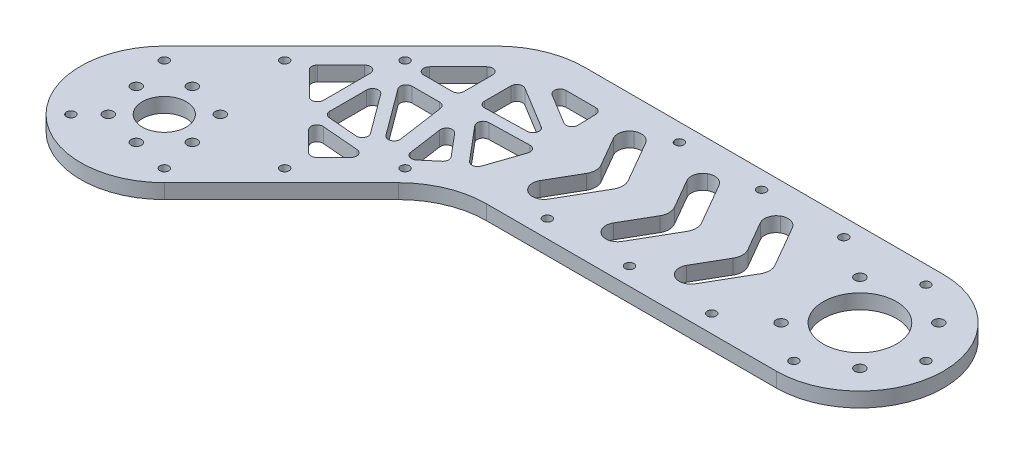
from build123d import *

# Parameters (mm, degrees)
SKETCH_1_R          = 28.5
EXTRUDE_1_DEPTH     = 5
FILLET_1_R          = 30
FILLET_2_R          = 30
CUT_EXTRUDE_1_DEPTH = 17
FILLET_3_R          = 5
FILLET_4_R          = 4
SKETCH_3_R          = 1.75
CUT_EXTRUDE_2_DEPTH = 22
SKETCH_4_R          = 1.75
CUT_EXTRUDE_3_DEPTH = 9
CUT_EXTRUDE_6_DEPTH = 10
FILLET_7_R          = 2
FILLET_8_R          = 2
SKETCH_8_R          = 1.5
CUT_EXTRUDE_7_DEPTH = 10
SKETCH_10_R         = 7.5
SKETCH_10_R_2       = 12.5
CUT_EXTRUDE_8_DEPTH = 10


with BuildPart() as part:
    # 草图1 → 凸台-拉伸1 (new body)
    with BuildSketch(Plane(origin=(0, 0, 0), x_dir=(1, 0, 0), z_dir=(0, 1, 0))):
        with BuildLine():
            Line((45.194913472, 85.5), (-20.152543264, 20.152543264))
            ThreePointArc((-20.152543264, 20.152543264), (10.906477822, 26.330566677), (28.5, 0))
            ThreePointArc((28.5, 0), (26.330566677, -10.906477822), (20.152543264, -20.152543264))
            Line((20.152543264, -20.152543264), (68.805086528, 28.5))
            Line((68.805086528, 28.5), (180, 28.5))
            ThreePointArc((180, 28.5), (151.5, 57), (180, 85.5))
            Line((180, 85.5), (45.194913472, 85.5))
        make_face()
        Circle(SKETCH_1_R)
        with Locations((180, 57)):
            Circle(SKETCH_1_R)
    extrude(amount=EXTRUDE_1_DEPTH)

    # 圆角1
    fillet_1_edges = [part.edges().sort_by_distance(p)[0] for p in [
        (68.805086528, 2.5, -28.5),
    ]]
    fillet(fillet_1_edges, radius=FILLET_1_R)

    # 圆角2
    fillet_2_edges = [part.edges().sort_by_distance(p)[0] for p in [
        (45.194913472, 2.5, -85.5),
    ]]
    fillet(fillet_2_edges, radius=FILLET_2_R)

    # 草图2 → 切除-拉伸1 (cut)
    with BuildSketch(Plane(origin=(0, 5, 0), x_dir=(1, 0, 0), z_dir=(0, 1, 0))):
        Polygon((150, 57), (138.452994616, 77), (131.524791386, 73), (140.762395693, 57), (131.524791386, 41), (138.452994616, 37), align=None)
        Polygon((106.524791386, 41), (115.762395693, 57), (106.524791386, 73), (113.452994616, 77), (125, 57), (113.452994616, 37), align=None)
        Polygon((81.524791386, 41), (90.762395693, 57), (81.524791386, 73), (88.452994616, 77), (100, 57), (88.452994616, 37), align=None)
    extrude(amount=-CUT_EXTRUDE_1_DEPTH, mode=Mode.SUBTRACT)

    # 圆角3
    fillet_3_edges = [part.edges().sort_by_distance(p)[0] for p in [
        (150, 2.5, -57),
        (140.762395693, 2.5, -57),
        (125, 2.5, -57),
        (115.762395693, 2.5, -57),
        (100, 2.5, -57),
        (90.762395693, 2.5, -57),
    ]]
    fillet(fillet_3_edges, radius=FILLET_3_R)

    # 圆角4
    fillet_4_edges = [part.edges().sort_by_distance(p)[0] for p in [
        (88.452994616, 2.5, -37),
        (81.524791386, 2.5, -41),
        (81.524791386, 2.5, -73),
        (106.524791386, 2.5, -73),
        (88.452994616, 2.5, -77),
        (113.452994616, 2.5, -77),
        (113.452994616, 2.5, -37),
        (106.524791386, 2.5, -41),
        (131.524791386, 2.5, -41),
        (138.452994616, 2.5, -37),
        (131.524791386, 2.5, -73),
        (138.452994616, 2.5, -77),
    ]]
    fillet(fillet_4_edges, radius=FILLET_4_R - 0.0001)  # a hair under: the kernel refuses the full size

    # 草图3 → 切除-拉伸2 (cut)
    with BuildSketch(Plane.XZ):
        with Locations(Location((193.435028843, -43.564971157, 0), (0, 0, 270))):
            Circle(SKETCH_3_R)
        with Locations(Location((193.435028843, -70.435028843, 0), (0, 0, 270))):
            Circle(SKETCH_3_R)
        with Locations(Location((166.564971157, -70.435028843, 0), (0, 0, 270))):
            Circle(SKETCH_3_R)
        with Locations(Location((166.564971157, -43.564971157, 0), (0, 0, 270))):
            Circle(SKETCH_3_R)
    extrude(amount=-CUT_EXTRUDE_2_DEPTH, mode=Mode.SUBTRACT)

    # 草图4 → 切除-拉伸3 (cut)
    with BuildSketch(Plane.XZ):
        with Locations(Location((3.494057109, 13.039998655, 0), (0, 0, 270))):
            Circle(SKETCH_4_R)
        with Locations(Location((-9.545941546, 9.545941546, 0), (0, 0, 270))):
            Circle(SKETCH_4_R)
        with Locations(Location((13.039998655, 3.494057109, 0), (0, 0, 270))):
            Circle(SKETCH_4_R)
        with Locations(Location((9.545941546, -9.545941546, 0), (0, 0, 270))):
            Circle(SKETCH_4_R)
        with Locations(Location((-3.494057109, -13.039998655, 0), (0, 0, 270))):
            Circle(SKETCH_4_R)
        with Locations(Location((-13.039998655, -3.494057109, 0), (0, 0, 270))):
            Circle(SKETCH_4_R)
    extrude(amount=-CUT_EXTRUDE_3_DEPTH, mode=Mode.SUBTRACT)

    # 草图7 → 切除-拉伸6 (cut)
    with BuildSketch(Plane(origin=(0, 5, 0), x_dir=(1, 0, 0), z_dir=(0, 1, 0))):
        Polygon((37.302376212, 11.879439437), (47.541331092, 22.118394317), (25.250183738, 23.931631911), align=None)
        Polygon((73.460547005, 75.506086264), (73.757768972, 63.62598632), (54.226268855, 75.506086264), align=None)
        Polygon((44.294954722, 72.402288525), (27.711693587, 55.81902739), (44.294954722, 55.81902739), align=None)
        Polygon((50.636885885, 71.015195544), (50.636885885, 56.423531637), (73.678593841, 57), align=None)
        Polygon((53.527673936, 52.761285689), (74.259925291, 53.279974973), (68.127983229, 35.438389149), align=None)
        Polygon((53.678821017, 27.188173586), (62.701661284, 34.792921342), (50.530965527, 49.233143064), align=None)
        Polygon((45.047320543, 50.522356459), (29.922245502, 50.522356459), (48.667218123, 25.171595633), align=None)
        Polygon((22.958665814, 52.076760267), (10.138217033, 39.256311486), (22.958665814, 26.435862705), align=None)
        Polygon((27.261857105, 47.74792215), (43.379167297, 25.950820384), (27.261857105, 27.261857105), align=None)
    extrude(amount=-CUT_EXTRUDE_6_DEPTH, mode=Mode.SUBTRACT)

    # 圆角7
    fillet_7_edges = [part.edges().sort_by_distance(p)[0] for p in [
        (44.294954722, 2.5, -72.402288525),
        (44.294954722, 2.5, -55.81902739),
        (27.711693587, 2.5, -55.81902739),
        (50.636885885, 2.5, -71.015195544),
        (73.678593841, 2.5, -57),
        (50.636885885, 2.5, -56.423531637),
        (68.127983229, 2.5, -35.438389149),
        (53.527673936, 2.5, -52.761285689),
        (74.259925291, 2.5, -53.279974973),
        (53.678821017, 2.5, -27.188173586),
        (50.530965527, 2.5, -49.233143064),
        (62.701661284, 2.5, -34.792921342),
        (45.047320543, 2.5, -50.522356459),
        (48.667218123, 2.5, -25.171595633),
        (29.922245502, 2.5, -50.522356459),
        (54.226268855, 2.5, -75.506086264),
        (73.460547005, 2.5, -75.506086264),
        (73.757768972, 2.5, -63.62598632),
    ]]
    fillet(fillet_7_edges, radius=FILLET_7_R)

    # 圆角8
    fillet_8_edges = [part.edges().sort_by_distance(p)[0] for p in [
        (37.302376212, 2.5, -11.879439437),
        (25.250183738, 2.5, -23.931631911),
        (47.541331092, 2.5, -22.118394317),
        (22.958665814, 2.5, -52.076760267),
        (22.958665814, 2.5, -26.435862705),
        (10.138217033, 2.5, -39.256311486),
        (27.261857105, 2.5, -27.261857105),
        (27.261857105, 2.5, -47.74792215),
        (43.379167297, 2.5, -25.950820384),
    ]]
    fillet(fillet_8_edges, radius=FILLET_8_R)

    # 草图8 → 切除-拉伸7 (cut)
    with BuildSketch(Plane(origin=(0, 5, 0), x_dir=(1, 0, 0), z_dir=(0, 1, 0))):
        with Locations(Location((-15.909902577, -15.909902577, 0), (0, 0, 270))):
            Circle(SKETCH_8_R)
        with Locations(Location((-15.909902577, 15.909902577, 0), (0, 0, 270))):
            Circle(SKETCH_8_R)
        with Locations(Location((15.909902577, -15.909902577, 0), (0, 0, 270))):
            Circle(SKETCH_8_R)
        with Locations(Location((4.596194078, 36.415999231, 0), (0, 0, 270))):
            Circle(SKETCH_8_R)
        with Locations(Location((25.102290732, 56.922095886, 0), (0, 0, 270))):
            Circle(SKETCH_8_R)
        with Locations(Location((36.415999231, 4.596194078, 0), (0, 0, 270))):
            Circle(SKETCH_8_R)
        with Locations(Location((56.922095886, 25.102290732, 0), (0, 0, 270))):
            Circle(SKETCH_8_R)
        with Locations(Location((180, 79.5, 0), (0, 0, 270))):
            Circle(SKETCH_8_R)
        with Locations(Location((180, 34.5, 0), (0, 0, 270))):
            Circle(SKETCH_8_R)
        with Locations(Location((152, 79.5, 0), (0, 0, 270))):
            Circle(SKETCH_8_R)
        with Locations(Location((124, 79.5, 0), (0, 0, 270))):
            Circle(SKETCH_8_R)
        with Locations(Location((96, 79.5, 0), (0, 0, 270))):
            Circle(SKETCH_8_R)
        with Locations(Location((152, 34.5, 0), (0, 0, 270))):
            Circle(SKETCH_8_R)
        with Locations(Location((124, 34.5, 0), (0, 0, 270))):
            Circle(SKETCH_8_R)
        with Locations(Location((96, 34.5, 0), (0, 0, 270))):
            Circle(SKETCH_8_R)
        with Locations(Location((202.5, 57, 0), (0, 0, 270))):
            Circle(SKETCH_8_R)
    extrude(amount=-CUT_EXTRUDE_7_DEPTH, mode=Mode.SUBTRACT)

    # 草图10 → 切除-拉伸8 (cut)
    with BuildSketch(Plane(origin=(0, 5, 0), x_dir=(1, 0, 0), z_dir=(0, 1, 0))):
        with Locations(Location((0, 0, 0), (0, 0, 270))):
            Circle(SKETCH_10_R)
        with Locations(Location((180, 57, 0), (0, 0, 270))):
            Circle(SKETCH_10_R_2)
    extrude(amount=-CUT_EXTRUDE_8_DEPTH, mode=Mode.SUBTRACT)


solid = part.part
